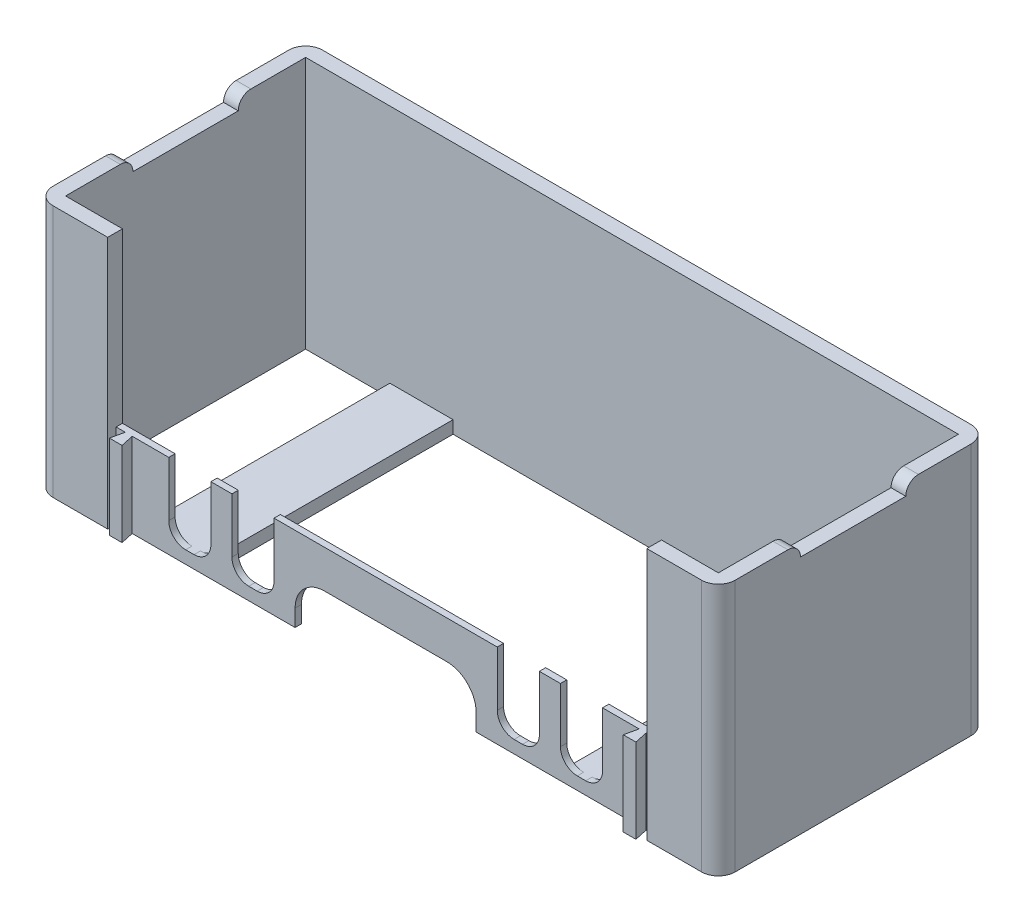
from build123d import *

# Parameters (mm, degrees)
SKETCH1_W           = 81
SKETCH1_H           = 32
BOSS_EXTRUDE1_DEPTH = 10
SKETCH2_W           = 77.5
SKETCH2_H           = 28.5
CUT_EXTRUDE1_DEPTH  = 10
SKETCH3_W           = 7.5
SKETCH3_H           = 32
BOSS_EXTRUDE2_DEPTH = 1.5
SKETCH4_W           = 64
SKETCH4_H           = 1
CUT_EXTRUDE2_DEPTH  = 10
BOSS_EXTRUDE3_DEPTH = 10
BOSS_EXTRUDE4_DEPTH = 10
FILLET1_R           = 2
FILLET2_R           = 2
FILLET3_R           = 2
FILLET4_R           = 2
CUT_EXTRUDE3_DEPTH  = 0.75
SKETCH8_W           = 21.5
SKETCH8_H           = 5.5
CUT_EXTRUDE4_DEPTH  = 0.75
FILLET5_R           = 3.5
FILLET6_R           = 3.5
BOSS_EXTRUDE5_START = 20
BOSS_EXTRUDE5_DEPTH = 20
SKETCH10_W          = 1.75
SKETCH10_H          = 12.5
CUT_EXTRUDE5_DEPTH  = 1.5
FILLET7_R           = 1.5
FILLET8_R           = 1.5
FILLET10_R          = 1.5
FILLET11_R          = 1.5


with BuildPart() as part:
    # Sketch1 → Boss-Extrude1 (new body)
    with BuildSketch(Plane(origin=(0, 0, 0), x_dir=(1, 0, 0), z_dir=(0, 1, 0))):
        with Locations((-86.056207425, -60.23876691)):
            Rectangle(SKETCH1_W, SKETCH1_H)
    extrude(amount=BOSS_EXTRUDE1_DEPTH)

    # Sketch2 → Cut-Extrude1 (cut)
    with BuildSketch(Plane(origin=(0, 10, 0), x_dir=(1, 0, 0), z_dir=(0, 1, 0))):
        with Locations((-86.056207425, -60.23876691)):
            Rectangle(SKETCH2_W, SKETCH2_H)
    extrude(amount=-CUT_EXTRUDE1_DEPTH, mode=Mode.SUBTRACT)

    # Sketch3 → Boss-Extrude2 (add)
    with BuildSketch(Plane(origin=(0, 0, 0), x_dir=(-1, 0, 0), z_dir=(0, -1, 0))):
        with Locations((61.056207425, -60.23876691)):
            Rectangle(SKETCH3_W, SKETCH3_H)
        with Locations((111.056207425, -60.23876691)):
            Rectangle(SKETCH3_W, SKETCH3_H)
    extrude(amount=-BOSS_EXTRUDE2_DEPTH)

    # Sketch4 → Cut-Extrude2 (cut)
    with BuildSketch(Plane(origin=(0, 10, 0), x_dir=(1, 0, 0), z_dir=(0, 1, 0))):
        with Locations((-86.056207425, -75.73876691)):
            Rectangle(SKETCH4_W, SKETCH4_H)
    extrude(amount=-CUT_EXTRUDE2_DEPTH, mode=Mode.SUBTRACT)

    # Sketch5 → Boss-Extrude3 (add)
    with BuildSketch(Plane(origin=(0, 10, 0), x_dir=(1, 0, 0), z_dir=(0, 1, 0))):
        Polygon((-116.976207425, -75.23876691), (-117.306207425, -76.781751031), (-115.806207425, -76.781751031), (-116.146207425, -75.23876691), align=None)
    extrude(amount=-BOSS_EXTRUDE3_DEPTH)

    # Sketch6 → Boss-Extrude4 (add)
    with BuildSketch(Plane(origin=(0, 10, 0), x_dir=(1, 0, 0), z_dir=(0, 1, 0))):
        Polygon((-55.966207425, -75.23876691), (-56.306207425, -76.781751031), (-54.806207425, -76.781751031), (-55.136207425, -75.23876691), align=None)
    extrude(amount=-BOSS_EXTRUDE4_DEPTH)

    # Fillet1
    fillet1_edges = [part.edges().sort_by_distance(p)[0] for p in [
        (-126.556207425, 5, 76.23876691),
    ]]
    fillet(fillet1_edges, radius=FILLET1_R)

    # Fillet2
    fillet2_edges = [part.edges().sort_by_distance(p)[0] for p in [
        (-45.556207425, 5, 76.23876691),
    ]]
    fillet(fillet2_edges, radius=FILLET2_R)

    # Fillet3
    fillet3_edges = [part.edges().sort_by_distance(p)[0] for p in [
        (-45.556207425, 5, 44.23876691),
    ]]
    fillet(fillet3_edges, radius=FILLET3_R)

    # Fillet4
    fillet4_edges = [part.edges().sort_by_distance(p)[0] for p in [
        (-126.556207425, 5, 44.23876691),
    ]]
    fillet(fillet4_edges, radius=FILLET4_R)

    # Sketch7 → Cut-Extrude3 (cut)
    with BuildSketch(Plane.XY.offset(75.23876691)):
        with BuildLine():
            Line((-111.806207425, 10), (-106.806207425, 10))
            Line((-106.806207425, 10), (-106.806207425, 3.5))
            ThreePointArc((-106.806207425, 3.5), (-107.391993862, 2.085786438), (-108.806207425, 1.5))
            Line((-108.806207425, 1.5), (-109.806207425, 1.5))
            ThreePointArc((-109.806207425, 1.5), (-111.220420987, 2.085786438), (-111.806207425, 3.5))
            Line((-111.806207425, 3.5), (-111.806207425, 10))
        make_face()
        with BuildLine():
            Line((-65.306207425, 10), (-60.306207425, 10))
            Line((-60.306207425, 10), (-60.306207425, 3.5))
            ThreePointArc((-60.306207425, 3.5), (-60.891993862, 2.085786438), (-62.306207425, 1.5))
            Line((-62.306207425, 1.5), (-63.306207425, 1.5))
            ThreePointArc((-63.306207425, 1.5), (-64.720420987, 2.085786438), (-65.306207425, 3.5))
            Line((-65.306207425, 3.5), (-65.306207425, 10))
        make_face()
        with BuildLine():
            Line((-104.306207425, 10), (-99.306207425, 10))
            Line((-99.306207425, 10), (-99.306207425, 3.5))
            ThreePointArc((-99.306207425, 3.5), (-99.891993862, 2.085786438), (-101.306207425, 1.5))
            Line((-101.306207425, 1.5), (-102.306207425, 1.5))
            ThreePointArc((-102.306207425, 1.5), (-103.720420987, 2.085786438), (-104.306207425, 3.5))
            Line((-104.306207425, 3.5), (-104.306207425, 10))
        make_face()
        with BuildLine():
            Line((-72.806207425, 10), (-67.806207425, 10))
            Line((-67.806207425, 10), (-67.806207425, 3.5))
            ThreePointArc((-67.806207425, 3.5), (-68.391993862, 2.085786438), (-69.806207425, 1.5))
            Line((-69.806207425, 1.5), (-70.806207425, 1.5))
            ThreePointArc((-70.806207425, 1.5), (-72.220420987, 2.085786438), (-72.806207425, 3.5))
            Line((-72.806207425, 3.5), (-72.806207425, 10))
        make_face()
    extrude(amount=-CUT_EXTRUDE3_DEPTH, mode=Mode.SUBTRACT)

    # Sketch8 → Cut-Extrude4 (cut)
    with BuildSketch(Plane.XY.offset(75.23876691)):
        with Locations((-86.056207425, 2.75)):
            Rectangle(SKETCH8_W, SKETCH8_H)
    extrude(amount=-CUT_EXTRUDE4_DEPTH, mode=Mode.SUBTRACT)

    # Fillet5
    fillet5_edges = [part.edges().sort_by_distance(p)[0] for p in [
        (-96.806207425, 5.5, 74.86376691),
    ]]
    fillet(fillet5_edges, radius=FILLET5_R)

    # Fillet6
    fillet6_edges = [part.edges().sort_by_distance(p)[0] for p in [
        (-75.306207425, 5.5, 74.86376691),
    ]]
    fillet(fillet6_edges, radius=FILLET6_R)

    # Sketch9 → Boss-Extrude5 (add)
    with BuildSketch(Plane(origin=(0, 10, 0), x_dir=(1, 0, 0), z_dir=(0, 1, 0)).offset(BOSS_EXTRUDE5_START)):
        with BuildLine():
            Line((-47.556207425, -44.23876691), (-124.556207425, -44.23876691))
            ThreePointArc((-124.556207425, -44.23876691), (-125.970420987, -44.824553347), (-126.556207425, -46.23876691))
            Line((-126.556207425, -46.23876691), (-126.556207425, -74.23876691))
            ThreePointArc((-126.556207425, -74.23876691), (-125.970420987, -75.652980472), (-124.556207425, -76.23876691))
            Line((-124.556207425, -76.23876691), (-118.056207425, -76.23876691))
            Line((-118.056207425, -76.23876691), (-118.056207425, -75.23876691))
            Line((-118.056207425, -75.23876691), (-118.056207425, -74.48876691))
            Line((-118.056207425, -74.48876691), (-124.806207425, -74.48876691))
            Line((-124.806207425, -74.48876691), (-124.806207425, -45.98876691))
            Line((-124.806207425, -45.98876691), (-47.306207425, -45.98876691))
            Line((-47.306207425, -45.98876691), (-47.306207425, -74.48876691))
            Line((-47.306207425, -74.48876691), (-54.056207425, -74.48876691))
            Line((-54.056207425, -74.48876691), (-54.056207425, -75.23876691))
            Line((-54.056207425, -75.23876691), (-54.056207425, -76.23876691))
            Line((-54.056207425, -76.23876691), (-47.556207425, -76.23876691))
            ThreePointArc((-47.556207425, -76.23876691), (-46.141993862, -75.652980472), (-45.556207425, -74.23876691))
            Line((-45.556207425, -74.23876691), (-45.556207425, -46.23876691))
            ThreePointArc((-45.556207425, -46.23876691), (-46.141993862, -44.824553347), (-47.556207425, -44.23876691))
        make_face()
    extrude(amount=-BOSS_EXTRUDE5_DEPTH)

    # Sketch10 → Cut-Extrude5 (cut)
    with BuildSketch(Plane(origin=(0, 30, 0), x_dir=(1, 0, 0), z_dir=(0, 1, 0))):
        with Locations((-46.431207425, -60.23876691)):
            Rectangle(SKETCH10_W, SKETCH10_H)
        with Locations((-125.681207425, -60.23876691)):
            Rectangle(SKETCH10_W, SKETCH10_H)
    extrude(amount=-CUT_EXTRUDE5_DEPTH, mode=Mode.SUBTRACT)

    # Fillet7
    fillet7_edges = [part.edges().sort_by_distance(p)[0] for p in [
        (-125.681207425, 30, 66.48876691),
    ]]
    fillet(fillet7_edges, radius=FILLET7_R - 0.0001)  # a hair under: the kernel refuses the full size

    # Fillet8
    fillet8_edges = [part.edges().sort_by_distance(p)[0] for p in [
        (-125.681207425, 30, 53.98876691),
    ]]
    fillet(fillet8_edges, radius=FILLET8_R - 0.0001)  # a hair under: the kernel refuses the full size

    # Fillet10
    fillet10_edges = [part.edges().sort_by_distance(p)[0] for p in [
        (-46.431207425, 30, 53.98876691),
    ]]
    fillet(fillet10_edges, radius=FILLET10_R - 0.0001)  # a hair under: the kernel refuses the full size

    # Fillet11
    fillet11_edges = [part.edges().sort_by_distance(p)[0] for p in [
        (-46.431207425, 30, 66.48876691),
    ]]
    fillet(fillet11_edges, radius=FILLET11_R - 0.0001)  # a hair under: the kernel refuses the full size


solid = part.part
